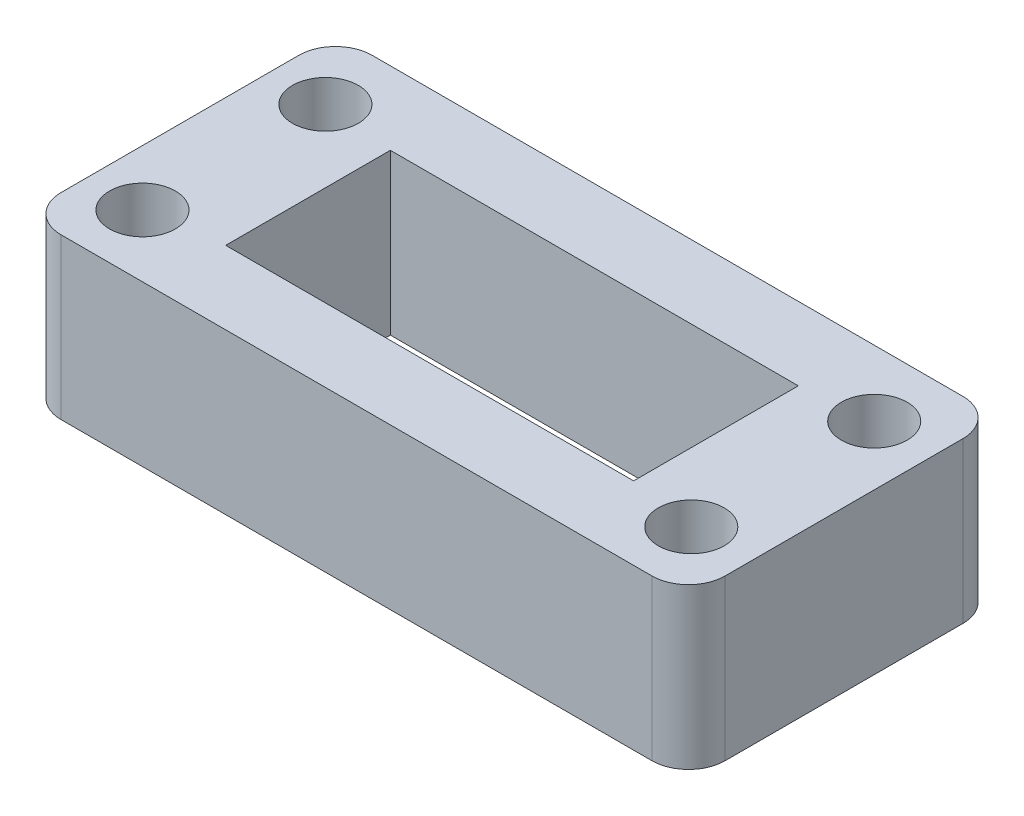
from build123d import *

# Parameters (mm, degrees)
SKETCH1_W            = 36.3
SKETCH1_H            = 17
SKETCH1_W_2          = 22.3
SKETCH1_H_2          = 9
BOSS_EXTRUDE1_DEPTH  = 8.75
M3_CLEARANCE_HOLE1_D = 3.6
FILLET1_R            = 2


with BuildPart() as part:
    # Sketch1 → Boss-Extrude1 (new body)
    with BuildSketch(Plane(origin=(0, 0, 0), x_dir=(1, 0, 0), z_dir=(0, 1, 0))):
        with Locations((18.15, 8.5)):
            Rectangle(SKETCH1_W, SKETCH1_H)
        with Locations((18.15, 8.5)):
            Rectangle(SKETCH1_W_2, SKETCH1_H_2, mode=Mode.SUBTRACT)
    extrude(amount=BOSS_EXTRUDE1_DEPTH)

    # M3 Clearance Hole1 (through all)
    with Locations(Plane(origin=(0, 8.75, 0), x_dir=(1, 0, 0), z_dir=(0, 1, 0))):
        with Locations((3.050005, 3.4), (33.050005, 3.4), (33.050005, 13.4), (3.050005, 13.4)):
            Hole(M3_CLEARANCE_HOLE1_D / 2)

    # Fillet1
    fillet1_edges = [part.edges().sort_by_distance(p)[0] for p in [
        (0, 4.375, -17),
        (36.3, 4.375, -17),
        (36.3, 4.375, 0),
        (0, 4.375, 0),
    ]]
    fillet(fillet1_edges, radius=FILLET1_R)


solid = part.part
